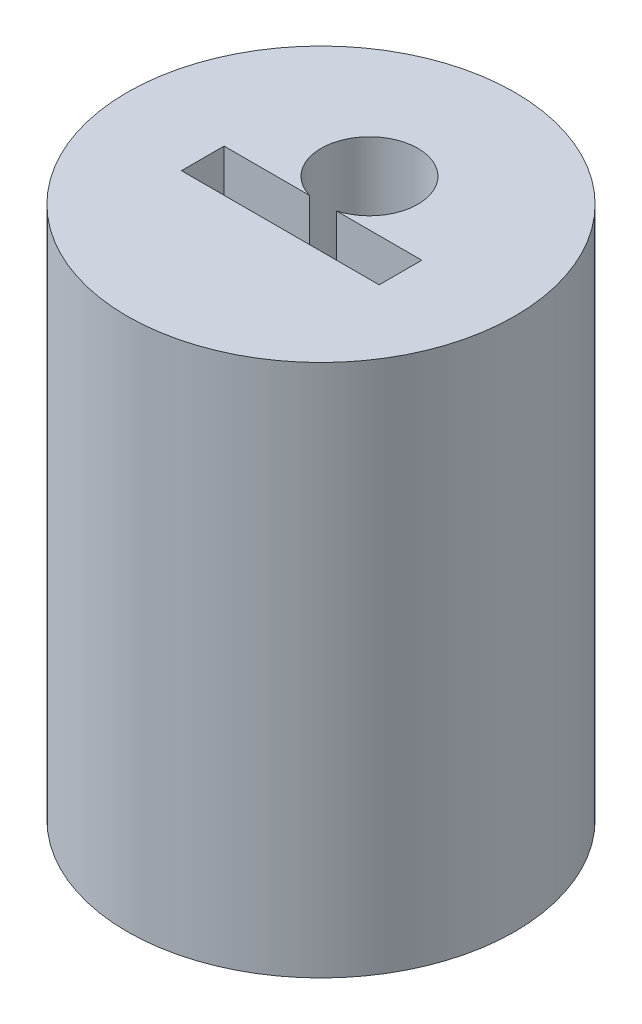
from build123d import *

# Parameters (mm, degrees)
SKETCH1_R           = 1
BOSS_EXTRUDE1_DEPTH = 1.25
SKETCH3_R           = 1
BOSS_EXTRUDE2_DEPTH = 0.25


with BuildPart() as part:
    # Sketch1 → Boss-Extrude1 (new, symmetric)
    with BuildSketch(Plane(origin=(0, 0, 0), x_dir=(1, 0, 0), z_dir=(0, 1, 0))):
        Circle(SKETCH1_R)
        with BuildLine():
            Line((-0.51, -0.21), (0.51, -0.21))
            Line((0.51, -0.21), (0.51, 0.01))
            Line((0.51, 0.01), (0.07, 0.01))
            ThreePointArc((0.07, 0.01), (0, 0.5), (-0.07, 0.01))
            Line((-0.07, 0.01), (-0.51, 0.01))
            Line((-0.51, 0.01), (-0.51, -0.21))
        make_face(mode=Mode.SUBTRACT)
    extrude(amount=BOSS_EXTRUDE1_DEPTH, both=True)

    # Sketch3 → Boss-Extrude2 (add)
    with BuildSketch(Plane.XZ.offset(1.25)):
        Circle(SKETCH3_R)
    extrude(amount=BOSS_EXTRUDE2_DEPTH)


solid = part.part
